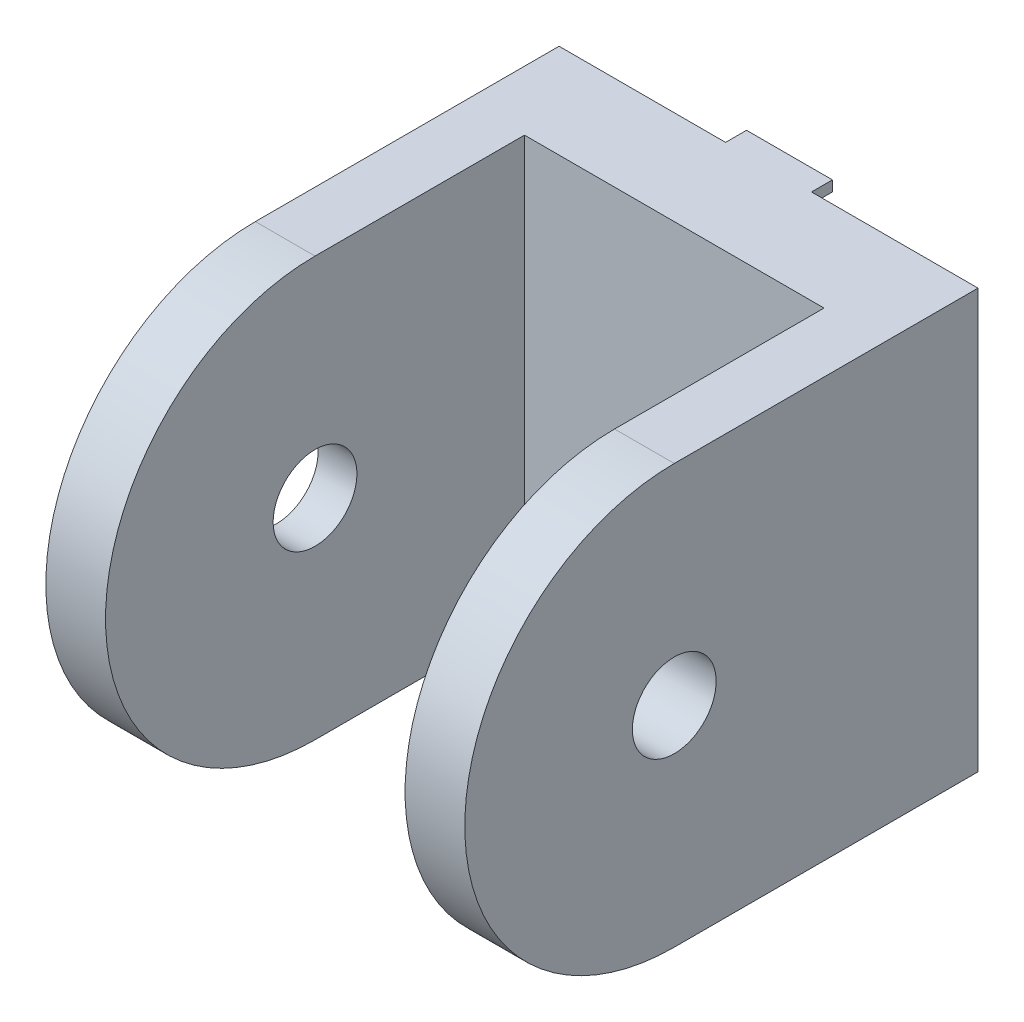
from build123d import *

# Parameters (mm, degrees)
SKETCH_1_W          = 40
SKETCH_1_H          = 40
EXTRUDE_1_DEPTH     = 9
SKETCH_2_W          = 5.7
SKETCH_2_H          = 40
EXTRUDE_2_DEPTH     = 40
CUT_EXTRUDE_START   = -40
CUT_EXTRUDE_2_DEPTH = 40
SKETCH_4_R          = 4
CUT_EXTRUDE_3_DEPTH = 67.340033162
SKETCH_5_R          = 8
CUT_EXTRUDE_4_DEPTH = 2
SKETCH_6_R          = 4
CUT_EXTRUDE_5_DEPTH = 49.989794856
SKETCH_7_W          = 8.2
SKETCH_7_H          = 1
EXTRUDE_3_DEPTH     = 2


# Read off the part's stored shape, not the designer's step: 切除-拉伸2
with BuildPart() as part:
    # 草图1 → 凸台-拉伸1 (new body)
    with BuildSketch(Plane.XY):
        Rectangle(SKETCH_1_W, SKETCH_1_H)
    extrude(amount=EXTRUDE_1_DEPTH)

    # 草图2 → 凸台-拉伸2 (add)
    with BuildSketch(Plane.XY.offset(9)):
        with Locations((-17.15, 0)):
            Rectangle(SKETCH_2_W, SKETCH_2_H)
        with Locations((17.15, 0)):
            Rectangle(SKETCH_2_W, SKETCH_2_H)
    extrude(amount=EXTRUDE_2_DEPTH)

    # 切除-拉伸2 outline → 切除-拉伸2 (cut)
    with BuildSketch(Plane.ZY.offset(20).offset(CUT_EXTRUDE_START)):
        with BuildLine():
            Line((49, 20), (29, 20))
            ThreePointArc((29, 20), (43.142135559, 14.142135688), (49, 1.83e-07))
            Line((49, 1.83e-07), (49, 20))
        make_face()
        with BuildLine():
            Line((49, -20), (49, 1.83e-07))
            ThreePointArc((49, 1.83e-07), (43.142135688, -14.142135559), (29, -20))
            Line((29, -20), (49, -20))
        make_face()
    extrude(amount=CUT_EXTRUDE_2_DEPTH, mode=Mode.SUBTRACT)

    # 草图4 → 切除-拉伸3 (cut, through all)
    with BuildSketch(Plane.ZY.offset(20)):
        with Locations((29, 0)):
            Circle(SKETCH_4_R)
    extrude(amount=-CUT_EXTRUDE_3_DEPTH, mode=Mode.SUBTRACT)

    # 草图5 → 切除-拉伸4 (cut)
    with BuildSketch(Plane.ZY.offset(20)):
        with Locations((29, 0)):
            Circle(SKETCH_5_R)
    extrude(amount=-CUT_EXTRUDE_4_DEPTH, mode=Mode.SUBTRACT)

    # 草图6 → 切除-拉伸5 (cut, through all)
    with BuildSketch(Plane.XY.offset(9)):
        Circle(SKETCH_6_R)
    extrude(amount=-CUT_EXTRUDE_5_DEPTH, mode=Mode.SUBTRACT)

    # 草图7 → 凸台-拉伸3 (add)
    with BuildSketch(Plane(origin=(0, 0, 0), x_dir=(-1, 0, 0), z_dir=(0, 0, -1))):
        with Locations((0, 19.5)):
            Rectangle(SKETCH_7_W, SKETCH_7_H)
        with Locations((0, -19.5)):
            Rectangle(SKETCH_7_W, SKETCH_7_H)
    extrude(amount=EXTRUDE_3_DEPTH)


solid = part.part
